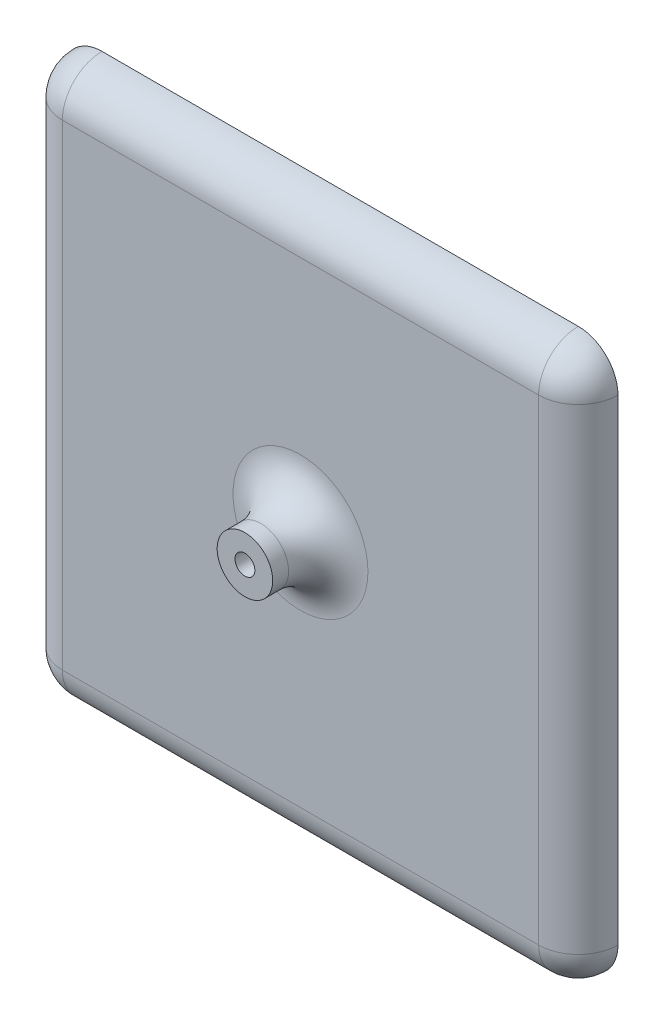
from build123d import *

# Parameters (mm, degrees)
ESBO_O1_W                = 140
ESBO_O1_H                = 140
ESBO_O1_R                = 2.5
RESSALTO_EXTRUS_O1_DEPTH = 10
ESBO_O2_R                = 7
ESBO_O2_R_2              = 2.5
RESSALTO_EXTRUS_O2_DEPTH = 24
FILETE1_R                = 10
FILETE2_R                = 10
FILETE3_R                = 10
FILETE4_R                = 10
FILETE5_R                = 10


with BuildPart() as part:
    # Esboço1 → Ressalto-extrusão1 (new body)
    with BuildSketch(Plane.XY):
        with Locations((34.130618452, 70)):
            Rectangle(ESBO_O1_W, ESBO_O1_H)
        with Locations((34.130618452, 70)):
            Circle(ESBO_O1_R, mode=Mode.SUBTRACT)
    extrude(amount=RESSALTO_EXTRUS_O1_DEPTH)

    # Esboço2 → Ressalto-extrusão2 (add)
    with BuildSketch(Plane.XY):
        with Locations(Location((34.130618452, 70, 0), (0, 0, 180))):
            Circle(ESBO_O2_R)
        with Locations((34.130618452, 70)):
            Circle(ESBO_O2_R_2, mode=Mode.SUBTRACT)
    extrude(amount=RESSALTO_EXTRUS_O2_DEPTH)

    # Filete1
    filete1_edges = [part.edges().sort_by_distance(p)[0] for p in [
        (34.130618452, 0, 10),
    ]]
    fillet(filete1_edges, radius=FILETE1_R - 0.0001)  # a hair under: the kernel refuses the full size

    # Filete2
    filete2_edges = [part.edges().sort_by_distance(p)[0] for p in [
        (34.130618452, 140, 10),
    ]]
    fillet(filete2_edges, radius=FILETE2_R - 0.0001)  # a hair under: the kernel refuses the full size

    # Filete3
    filete3_edges = [part.edges().sort_by_distance(p)[0] for p in [
        (-35.869381548, 2.928902899, 7.071097101),
        (-35.869381548, 70, 10),
        (-35.869381548, 137.071097101, 7.071097101),
    ]]
    fillet(filete3_edges, radius=FILETE3_R - 0.0001)  # a hair under: the kernel refuses the full size

    # Filete4
    filete4_edges = [part.edges().sort_by_distance(p)[0] for p in [
        (104.130618452, 70, 10),
        (104.130618452, 2.928902899, 7.071097101),
        (104.130618452, 137.071097101, 7.071097101),
    ]]
    fillet(filete4_edges, radius=FILETE4_R - 0.0001)  # a hair under: the kernel refuses the full size

    # Filete5
    filete5_edges = [part.edges().sort_by_distance(p)[0] for p in [
        (41.130618452, 70, 10),
    ]]
    fillet(filete5_edges, radius=FILETE5_R)


solid = part.part
